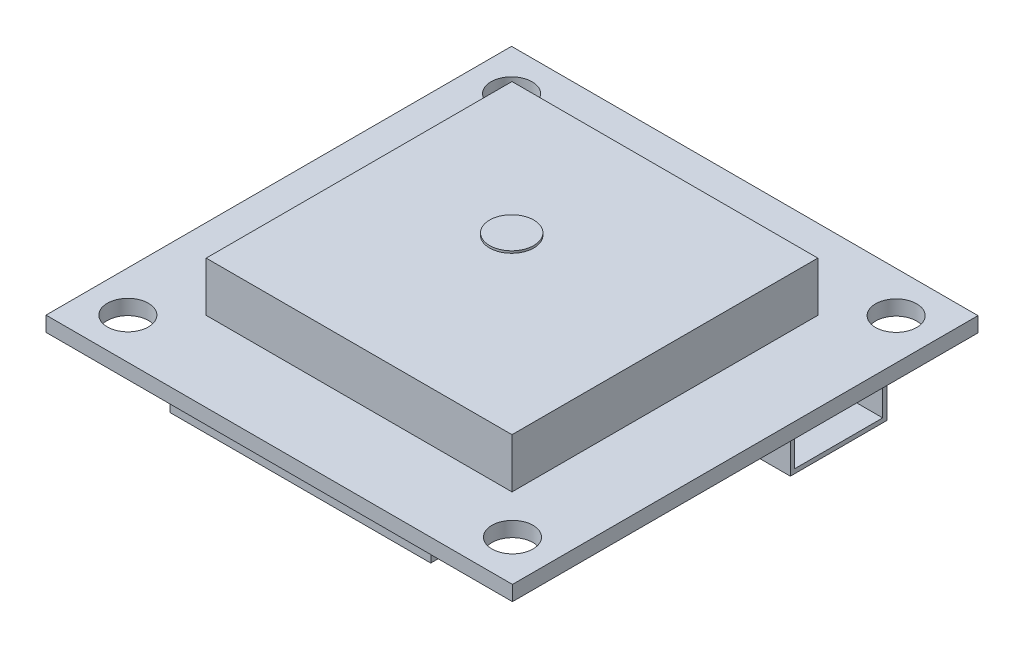
from build123d import *

# Parameters (mm, degrees)
SKETCH1_W           = 38.354
SKETCH1_H           = 38.2778
BOARD_DEPTH         = 1.2319
SKETCH3_W           = 25.146
SKETCH3_H           = 25.146
GPS_DEPTH           = 4.0767
SKETCH5_W           = 21.4376
SKETCH5_H           = 16.7894
UBLOCK_CHIP_DEPTH   = 2.4257
SKETCH6_R           = 3.3782
BATTERY_DEPTH       = 2.1082
SKETCH7_W           = 4.318
SKETCH7_H           = 7.9502
CONNECTOR_DEPTH     = 2.9972
SKETCH8_W           = 7.239
SKETCH8_H           = 2.286
CUT_EXTRUDE1_DEPTH  = 3.7592
CUT_EXTRUDE2_REACH  = 56.352
SKETCH9_R           = 1.6891
SKETCH10_R          = 1.8161
BOSS_EXTRUDE6_DEPTH = 0.1778


with BuildPart() as part:
    # Sketch1 → Board (new body)
    with BuildSketch(Plane(origin=(0, 0, 0), x_dir=(1, 0, 0), z_dir=(0, 1, 0))):
        with Locations((19.177, 19.1389)):
            Rectangle(SKETCH1_W, SKETCH1_H)
    extrude(amount=BOARD_DEPTH)

    # Sketch3 → GPS (add)
    with BuildSketch(Plane(origin=(0, 1.2319, 0), x_dir=(1, 0, 0), z_dir=(0, 1, 0))):
        with Locations((19.177, 19.1389)):
            Rectangle(SKETCH3_W, SKETCH3_H)
    extrude(amount=GPS_DEPTH)

    # Sketch5 → uBlock chip (add)
    with BuildSketch(Plane.XZ):
        with Locations((19.1008, -10.2108)):
            Rectangle(SKETCH5_W, SKETCH5_H)
    extrude(amount=UBLOCK_CHIP_DEPTH)

    # Sketch6 → Battery (add)
    with BuildSketch(Plane(origin=(0, 0, 0), x_dir=(-1, 0, 0), z_dir=(0, -1, 0))):
        with Locations((-22.2758, 32.6263)):
            Circle(SKETCH6_R)
    extrude(amount=BATTERY_DEPTH)

    # Sketch7 → Connector (add)
    with BuildSketch(Plane(origin=(0, 0, 0), x_dir=(-1, 0, 0), z_dir=(0, -1, 0))):
        with Locations((-35.687, 27.3304)):
            Rectangle(SKETCH7_W, SKETCH7_H)
    extrude(amount=CONNECTOR_DEPTH)

    # Sketch8 → Cut-Extrude1 (cut)
    with BuildSketch(Plane(origin=(37.846, 0, 0), x_dir=(0, 0, -1), z_dir=(1, 0, 0))):
        with Locations((27.3304, -1.4986)):
            Rectangle(SKETCH8_W, SKETCH8_H)
    extrude(amount=-CUT_EXTRUDE1_DEPTH, mode=Mode.SUBTRACT)

    # Sketch9 → Cut-Extrude2 (cut, up to next)
    with BuildSketch(Plane(origin=(0, 1.2319, 0), x_dir=(1, 0, 0), z_dir=(0, 1, 0)), mode=Mode.PRIVATE) as cut_extrude2_sk1:
        with Locations((34.9885, 3.3655)):
            Circle(SKETCH9_R)
    cut_extrude2_tool1 = extrude(cut_extrude2_sk1.sketch, amount=-CUT_EXTRUDE2_REACH, mode=Mode.PRIVATE) & part.part
    # Sketch9 → Cut-Extrude2 (cut, up to next)
    with BuildSketch(Plane(origin=(0, 1.2319, 0), x_dir=(1, 0, 0), z_dir=(0, 1, 0)), mode=Mode.PRIVATE) as cut_extrude2_sk2:
        with Locations((3.3655, 3.3655)):
            Circle(SKETCH9_R)
    cut_extrude2_tool2 = extrude(cut_extrude2_sk2.sketch, amount=-CUT_EXTRUDE2_REACH, mode=Mode.PRIVATE) & part.part
    # Sketch9 → Cut-Extrude2 (cut, up to next)
    with BuildSketch(Plane(origin=(0, 1.2319, 0), x_dir=(1, 0, 0), z_dir=(0, 1, 0)), mode=Mode.PRIVATE) as cut_extrude2_sk3:
        with Locations((3.3655, 34.9123)):
            Circle(SKETCH9_R)
    cut_extrude2_tool3 = extrude(cut_extrude2_sk3.sketch, amount=-CUT_EXTRUDE2_REACH, mode=Mode.PRIVATE) & part.part
    # Sketch9 → Cut-Extrude2 (cut, up to next)
    with BuildSketch(Plane(origin=(0, 1.2319, 0), x_dir=(1, 0, 0), z_dir=(0, 1, 0)), mode=Mode.PRIVATE) as cut_extrude2_sk4:
        with Locations((34.9885, 34.9123)):
            Circle(SKETCH9_R)
    cut_extrude2_tool4 = extrude(cut_extrude2_sk4.sketch, amount=-CUT_EXTRUDE2_REACH, mode=Mode.PRIVATE) & part.part
    add(cut_extrude2_tool1.solids().sort_by_distance((34.9885, 1.2319, -3.3655))[0], mode=Mode.SUBTRACT)
    add(cut_extrude2_tool2.solids().sort_by_distance((3.3655, 1.2319, -3.3655))[0], mode=Mode.SUBTRACT)
    add(cut_extrude2_tool3.solids().sort_by_distance((3.3655, 1.2319, -34.9123))[0], mode=Mode.SUBTRACT)
    add(cut_extrude2_tool4.solids().sort_by_distance((34.9885, 1.2319, -34.9123))[0], mode=Mode.SUBTRACT)

    # Sketch10 → Boss-Extrude6 (add)
    with BuildSketch(Plane(origin=(0, 5.3086, 0), x_dir=(1, 0, 0), z_dir=(0, 1, 0))):
        with Locations((17.5387, 20.7518)):
            Circle(SKETCH10_R)
    extrude(amount=BOSS_EXTRUDE6_DEPTH)


solid = part.part
